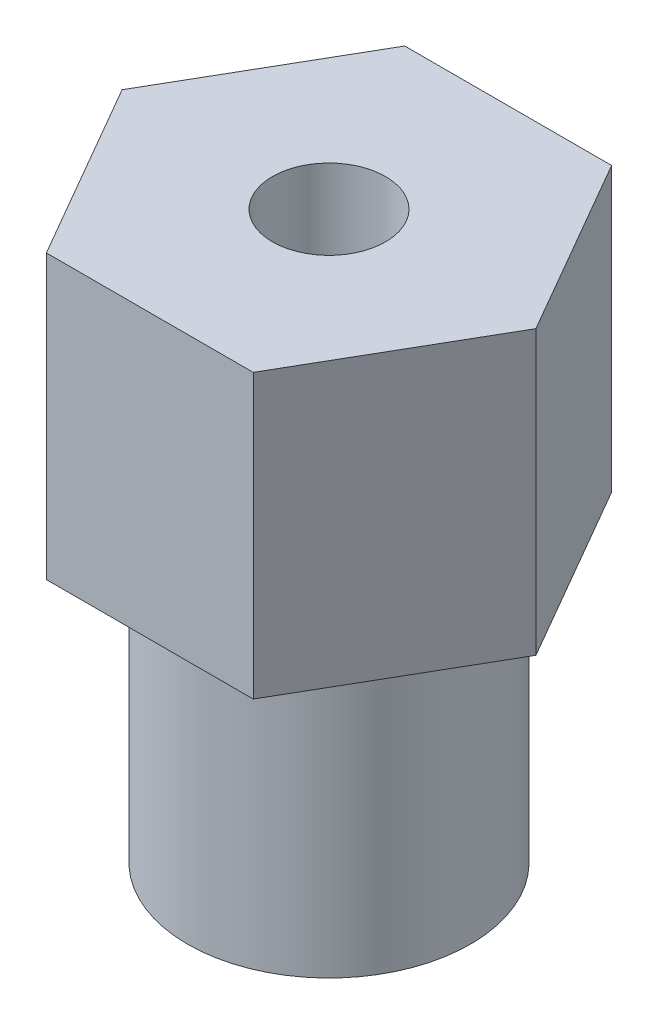
from build123d import *

# Parameters (mm, degrees)
SZKIC1_R                    = 3
DODANIE_WYCI_GNI_CIE1_DEPTH = 15
DODANIE_WYCI_GNI_CIE2_START = -15
SZKIC1_3_R                  = 7.5
SZKIC1_3_R_2                = 3
DODANIE_WYCI_GNI_CIE2_DEPTH = 15


with BuildPart() as part:
    # Szkic1 → Dodanie-wyciągnięcie1 (new body)
    with BuildSketch(Plane(origin=(0, 0, 0), x_dir=(1, 0, 0), z_dir=(0, 1, 0))):
        Polygon((5.484827557, -9.5), (10.969655115, 0), (5.484827557, 9.5), (-5.484827557, 9.5), (-10.969655115, 0), (-5.484827557, -9.5), align=None)
        Circle(SZKIC1_R, mode=Mode.SUBTRACT)
    extrude(amount=DODANIE_WYCI_GNI_CIE1_DEPTH)

    # Szkic1<3> → Dodanie-wyciągnięcie2 (add)
    with BuildSketch(Plane(origin=(0, 0, 0), x_dir=(1, 0, 0), z_dir=(0, 1, 0)).offset(DODANIE_WYCI_GNI_CIE2_START)):
        Circle(SZKIC1_3_R)
        Circle(SZKIC1_3_R_2, mode=Mode.SUBTRACT)
    extrude(amount=DODANIE_WYCI_GNI_CIE2_DEPTH)


solid = part.part
